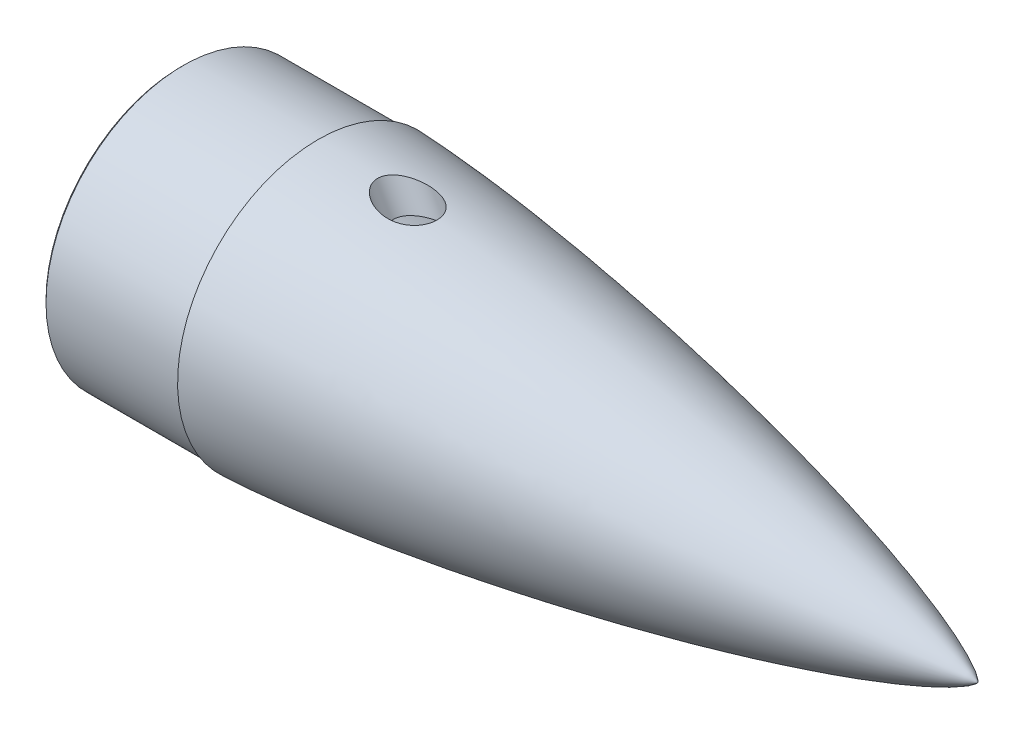
from build123d import *

# Parameters (mm, degrees)
CHAMFER1_SIZE                   = 1.5
TAP_DRILL_FOR_1_HELICOIL1_D     = 6.7564
TAP_DRILL_FOR_1_HELICOIL1_DEPTH = 9.525
CIRPATTERN1_COUNT               = 6
SKETCH26_R                      = 15
CUT_EXTRUDE5_DEPTH              = 50
CUT_EXTRUDE6_START              = 50
SKETCH26_2_R                    = 15
CUT_EXTRUDE6_DEPTH              = 50


with BuildPart() as part:
    # Sketch10 → Revolve1 (revolve)
    with BuildSketch(Plane.XY):
        with BuildLine():
            Line((11.112493743, 81.99983), (11.112493743, 67.49983))
            Line((11.112493743, 67.49983), (129.304508698, 67.49983))
            add(Edge.make_bspline(
                [(368.967251823, 0), (368.965299543, 0.012338489), (368.959416882, 0.036518378), (368.940636147, 0.082964007), (368.902304552, 0.158736421), (368.845538097, 0.250270687), (368.755690124, 0.376555746), (368.616653262, 0.54835284), (368.392888737, 0.793577299), (368.008659121, 1.164904965), (367.344738263, 1.729853685), (366.176060796, 2.601559154), (364.09282389, 3.960032328), (360.425978756, 6.040734396), (354.402196649, 9.01831007), (344.042994901, 13.507695011), (329.152005398, 19.128483965), (310.425167902, 25.398569259), (288.741266406, 31.933693508), (266.378532845, 38.106125474), (243.901379123, 43.846895186), (221.331994001, 49.212017941), (198.683967629, 54.234500927), (175.966897581, 58.934255644), (156.034567874, 62.771715365), (141.509051931, 65.395628269), (132.679425236, 66.924517444), (129.562757302, 67.455859883), (129.304508698, 67.49983)],
                knots=[0, 0, 0, 0, 0, 0.000134949, 0.000269899, 0.000539798, 0.000919537, 0.001299277, 0.001947431, 0.00293136, 0.004511869, 0.007081312, 0.011380263, 0.018707867, 0.031423867, 0.052705479, 0.084103008, 0.140910136, 0.203703492, 0.266497064, 0.329290816, 0.392084375, 0.454877964, 0.517671564, 0.580465191, 0.643258828, 0.674655593, 0.677492072, 0.677492072, 0.677492072, 0.677492072, 0.677492072], degree=4))
            Line((368.967251823, 0), (408.967251823, 0))
            add(Edge.make_bspline(
                [(408.967251823, 0), (408.964913524, 0.013501739), (408.958040758, 0.039916077), (408.936520441, 0.090485698), (408.892222076, 0.174057132), (408.826281575, 0.275556803), (408.721696416, 0.415833756), (408.561101809, 0.605075245), (408.30561918, 0.87242415), (407.86966713, 1.275299562), (407.120955138, 1.885142115), (405.803773451, 2.82590185), (403.46240692, 4.287152794), (399.325294488, 6.531818454), (392.481146888, 9.758904649), (380.662076725, 14.628008466), (363.637187185, 20.711720382), (342.215241093, 27.476512989), (317.428462321, 34.49762647), (291.879335737, 41.10482439), (266.21046092, 47.228993169), (240.44548836, 52.933436777), (214.598861982, 58.255439009), (188.68089566, 63.217582693), (165.946174917, 67.253280679), (146.421982586, 70.493799722), (130.127893898, 73.044947468), (117.078590637, 74.994157933), (104.015464216, 76.84854079), (92.573263959, 78.384492045), (82.757139441, 79.635603973), (74.571340184, 80.632219902), (68.019260454, 81.400804211), (61.463723364, 82.139375899), (54.90469802, 82.84637726), (48.342159918, 83.519940506), (41.776057559, 84.15778717), (36.02754108, 84.682157239), (31.097921259, 85.105234912), (26.988317923, 85.438669825), (23.699666618, 85.693218594), (20.085807822, 85.958448038), (16.719873821, 86.189018485), (13.602098287, 86.386966779), (10.732704013, 86.554575744), (8.436635008, 86.678703291), (6.139997341, 86.792157585), (4.129892063, 86.879313264), (2.40653858, 86.944618982), (1.257348635, 86.979022496), (0.68269791, 86.99491462), (0.395312527, 86.99983)],
                knots=[0, 0, 0, 0, 0, 0.000130123, 0.000260245, 0.000520491, 0.000900391, 0.00128029, 0.001925099, 0.002881508, 0.004418208, 0.006927086, 0.011110697, 0.018279138, 0.03067276, 0.051704469, 0.08310228, 0.139908797, 0.202702513, 0.265496165, 0.328289682, 0.391083359, 0.453876973, 0.516670577, 0.579464197, 0.642257765, 0.673654596, 0.705051427, 0.736448267, 0.767845106, 0.799241874, 0.814940257, 0.830638641, 0.846337073, 0.862035505, 0.877733936, 0.893432368, 0.90913072, 0.924829072, 0.932678248, 0.940527424, 0.9483766, 0.956225776, 0.967169332, 0.97264111, 0.978112888, 0.983584666, 0.989056444, 0.994528222, 0.997264111, 1, 1, 1, 1, 1], degree=4))
            Line((0.395312527, 86.99983), (0.395312527, 84.99983))
            Line((0.395312527, 84.99983), (-84.604517473, 84.99983))
            Line((-84.604517473, 84.99983), (-84.604517473, 81.99983))
            Line((-84.604517473, 81.99983), (11.112493743, 81.99983))
        make_face()
    revolve(axis=Axis((433.645840287, 0, 0), (-1, 0, 0)))

    # Chamfer1
    chamfer1_edges = [part.edges().sort_by_distance(p)[0] for p in [
        (-84.604517473, -84.99983, 0),
    ]]
    chamfer(chamfer1_edges, length=CHAMFER1_SIZE)

    # Tap Drill for #1 Helicoil1
    with Locations(Plane.ZY.offset(-11.112493743)):
        with Locations((-36.562415, 63.327960427)):
            tap_drill_for_1_helicoil1 = Hole(TAP_DRILL_FOR_1_HELICOIL1_D / 2, depth=TAP_DRILL_FOR_1_HELICOIL1_DEPTH)

    # CirPattern1: Tap Drill for #1 Helicoil1 ×6 about axis
    cirpattern1_axis = Axis((11.112493743, 0, 0), (1, 0, 0))
    for i in range(1, CIRPATTERN1_COUNT):
        add(tap_drill_for_1_helicoil1.rotate(cirpattern1_axis, i * 360 / CIRPATTERN1_COUNT), mode=Mode.SUBTRACT)

    # Sketch26 → Cut-Extrude5 (cut)
    with BuildSketch(Plane(origin=(-16.431060981, 28.459432441, 0), x_dir=(0, 0, 1), z_dir=(-0.500000000000001, 0.866025403784438, 0))):
        with Locations((0, 89.525578438)):
            Circle(SKETCH26_R)
    extrude(amount=-CUT_EXTRUDE5_DEPTH, mode=Mode.SUBTRACT)

    # Sketch26<2> → Cut-Extrude6 (cut)
    with BuildSketch(Plane(origin=(-16.431060981, 28.459432441, 0), x_dir=(0, 0, 1), z_dir=(-0.500000000000001, 0.866025403784438, 0)).offset(CUT_EXTRUDE6_START)):
        with Locations((0, 89.525578438)):
            Circle(SKETCH26_2_R)
    extrude(amount=-CUT_EXTRUDE6_DEPTH, mode=Mode.SUBTRACT)


solid = part.part
